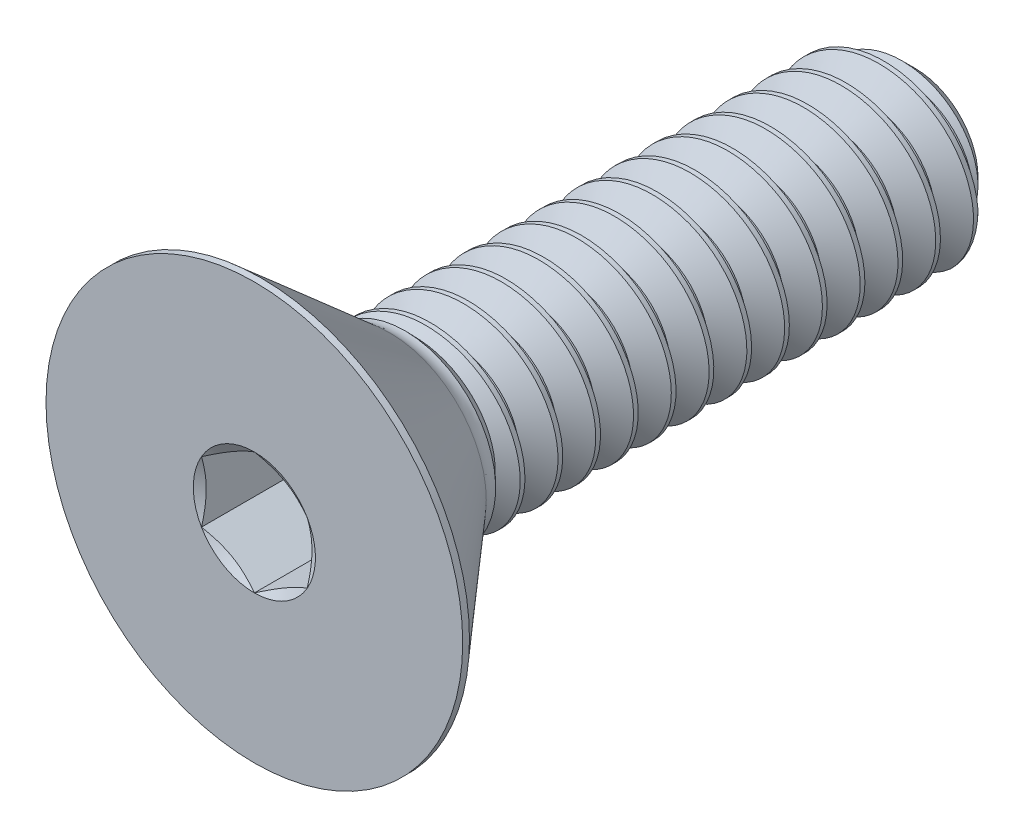
from build123d import *
from build123d.topology import SkipClean

# Parameters (mm, degrees)
SKETCH1_W          = 7.9375
SKETCH1_H          = 1.0922
CHAMFER1_SIZE      = 0.340178571
CUT_SWEEP1_PITCH   = 0.453571429
CUT_EXTRUDE2_DEPTH = 1.13792


with BuildPart() as part:
    # Sketch1 → Revolve1 (revolve)
    with BuildSketch(Plane(origin=(0, 0, 0), x_dir=(0, 0, -1), z_dir=(1, 0, 0)), mode=Mode.PRIVATE) as revolve1_sk:
        with Locations((3.96875, 0.5461)):
            Rectangle(SKETCH1_W, SKETCH1_H)
    revolve(revolve1_sk.sketch.rotate(Axis((0, 0, -7.9375), (0, 0, 1)), 90), axis=Axis((0, 0, -7.9375), (0, 0, 1)))

    # Chamfer1
    chamfer1_edges = [part.edges().sort_by_distance(p)[0] for p in [
        (1.0922, 0, -7.9375),
    ]]
    chamfer(chamfer1_edges, length=CHAMFER1_SIZE)

    # Cut-Sweep1: the profile of Sketch2 profile screwed along a right-hand helix of 17.5 turns, 6 arcs to a turn; built about Z, then put on its axis
    with SkipClean():  # the faces are left unmerged after this step: merging them gives an invalid solid
        cut_sweep1_z = Axis((0, 0, 0), (0, 0, 1))
        cut_sweep1_corners = [(1.0928, 0, 0.00034641), (1.0928, 0, -0.39722141), (0.797596715, 0, -0.226785714), (0.797596715, 0, -0.170089286)]
        with BuildLine(mode=Mode.PRIVATE) as cut_sweep1_profile:
            Line(cut_sweep1_corners[0], cut_sweep1_corners[1])
            Line(cut_sweep1_corners[1], cut_sweep1_corners[2])
            Line(cut_sweep1_corners[2], cut_sweep1_corners[3])
            Line(cut_sweep1_corners[3], cut_sweep1_corners[0])
        cut_sweep1_cap = Face(cut_sweep1_profile.wire())
        cut_sweep1_turn_angles = [0, 30, 60, 90, 120, 150, 180, 210, 240, 270, 300, 330, 360]
        cut_sweep1_turn_weights = [1, 0.8660254037844387, 1, 0.8660254037844387, 1, 0.8660254037844387, 1, 0.8660254037844387, 1, 0.8660254037844387, 1, 0.8660254037844387, 1]
        cut_sweep1_turn_rails = [Edge.make_bspline([Vector(p[0], p[1], 0).rotate(cut_sweep1_z, cut_sweep1_turn_angles[k]) / cut_sweep1_turn_weights[k] + Vector(0, 0, p[2] + CUT_SWEEP1_PITCH * cut_sweep1_turn_angles[k] / 360) for k in range(13)], [0, 0, 0, 1, 1, 2, 2, 3, 3, 4, 4, 5, 5, 6, 6, 6], 2, cut_sweep1_turn_weights) for p in cut_sweep1_corners]
        cut_sweep1_turn_sides = [Face.make_surface_from_curves(cut_sweep1_turn_rails[p[0]], cut_sweep1_turn_rails[p[1]]) for p in [(0, 1), (1, 2), (2, 3), (3, 0)]]
        cut_sweep1_last_angles = [6120, 6150, 6180, 6210, 6240, 6270, 6300]
        cut_sweep1_last_weights = [1, 0.8660254037844387, 1, 0.8660254037844387, 1, 0.8660254037842124, 1]
        cut_sweep1_last_rails = [Edge.make_bspline([Vector(p[0], p[1], 0).rotate(cut_sweep1_z, cut_sweep1_last_angles[k]) / cut_sweep1_last_weights[k] + Vector(0, 0, p[2] + CUT_SWEEP1_PITCH * cut_sweep1_last_angles[k] / 360) for k in range(7)], [0, 0, 0, 1, 1, 2, 2, 3, 3, 3], 2, cut_sweep1_last_weights) for p in cut_sweep1_corners]
        cut_sweep1_last_sides = [Face.make_surface_from_curves(cut_sweep1_last_rails[p[0]], cut_sweep1_last_rails[p[1]]) for p in [(0, 1), (1, 2), (2, 3), (3, 0)]]
        cut_sweep1 = Plane(origin=(0, 0, -7.9375), x_dir=(0, 1, 0), z_dir=(0, 0, 1)) * Solid(Shell([*[p.moved(Location((0, 0, CUT_SWEEP1_PITCH * i))) for i in range(17) for p in cut_sweep1_turn_sides], *cut_sweep1_last_sides, cut_sweep1_cap, cut_sweep1_cap.rotate(cut_sweep1_z, 6300).moved(Location((0, 0, CUT_SWEEP1_PITCH * 6300 / 360)))]))
        add(cut_sweep1, mode=Mode.SUBTRACT)

    # Sketch7 → Revolve2 (revolve)
    with BuildSketch(Plane(origin=(0, 0, 0), x_dir=(0, 0, -1), z_dir=(1, 0, 0)), mode=Mode.PRIVATE) as revolve2_sk:
        with BuildLine():
            Line((0, 2.5019), (0.08128, 2.5019))
            Line((0.08128, 2.5019), (1.6256, 1.159443105))
            ThreePointArc((1.6256, 1.159443105), (1.70944516, 1.109560477), (1.805449854, 1.0922))
            Line((1.805449854, 1.0922), (1.805449854, 0))
            Line((1.805449854, 0), (0, 0))
            Line((0, 0), (0, 2.5019))
        make_face()
    revolve(revolve2_sk.sketch.rotate(Axis((0, 0, 0), (0, 0, -1)), 180), axis=Axis((0, 0, 0), (0, 0, -1)))

    # Boss-Extrude1 cone 1 section (through the dimple's axis) → Boss-Extrude1 (revolve)
    with BuildSketch(Plane(origin=(0, 0, -1.805449854), x_dir=(0, -1, 0), z_dir=(1, 0, 0))):
        Polygon((0, 0), (1.0922, 0), (0, 1.05472528), align=None)
    revolve(axis=Axis((0, 0, -1.805449854), (0, 0, -1)))

    # Sketch5 → Cut-Extrude2 (cut)
    with BuildSketch(Plane.XY):
        Polygon((0, 0.733234842), (-0.635, 0.366617421), (-0.635, -0.366617421), (0, -0.733234842), (0.635, -0.366617421), (0.635, 0.366617421), align=None)
    extrude(amount=-CUT_EXTRUDE2_DEPTH, mode=Mode.SUBTRACT)

    # Cut-Extrude3 cone 1 section (through the dimple's axis) → Cut-Extrude3 (revolve, cut)
    with BuildSketch(Plane(origin=(0, 0, 0), x_dir=(0, -1, 0), z_dir=(1, 0, 0))):
        Polygon((0, 0), (0.733234842, 0), (0, 0.423333333), align=None)
    revolve(axis=Axis((0, 0, 0), (0, 0, -1)), mode=Mode.SUBTRACT)


solid = part.part
